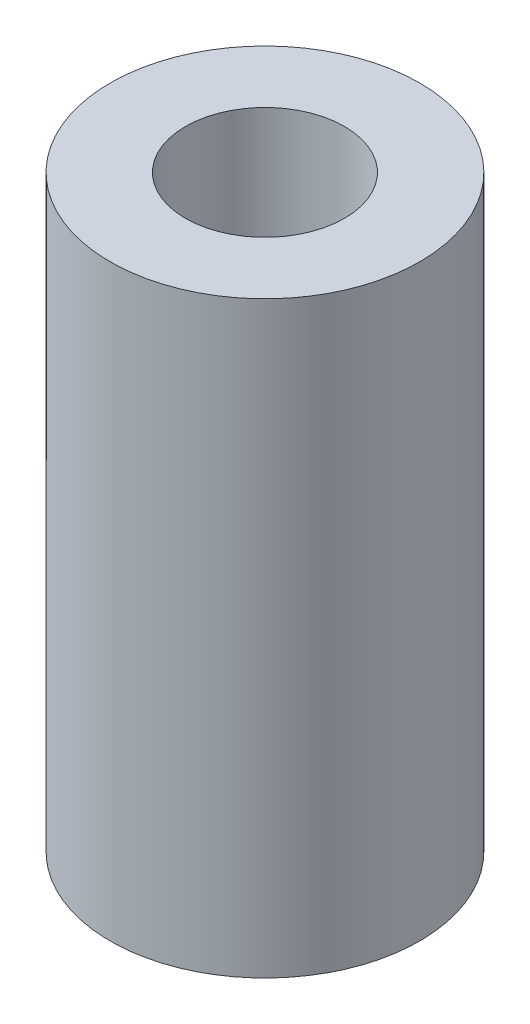
from build123d import *

# Parameters (mm, degrees)
SKETCH1_R           = 6.35
SKETCH1_R_2         = 3.2639
BOSS_EXTRUDE1_DEPTH = 24.13


with BuildPart() as part:
    # Sketch1 → Boss-Extrude1 (new body)
    with BuildSketch(Plane(origin=(0, 0, 0), x_dir=(1, 0, 0), z_dir=(0, 1, 0))):
        Circle(SKETCH1_R)
        Circle(SKETCH1_R_2, mode=Mode.SUBTRACT)
    extrude(amount=BOSS_EXTRUDE1_DEPTH)


solid = part.part
